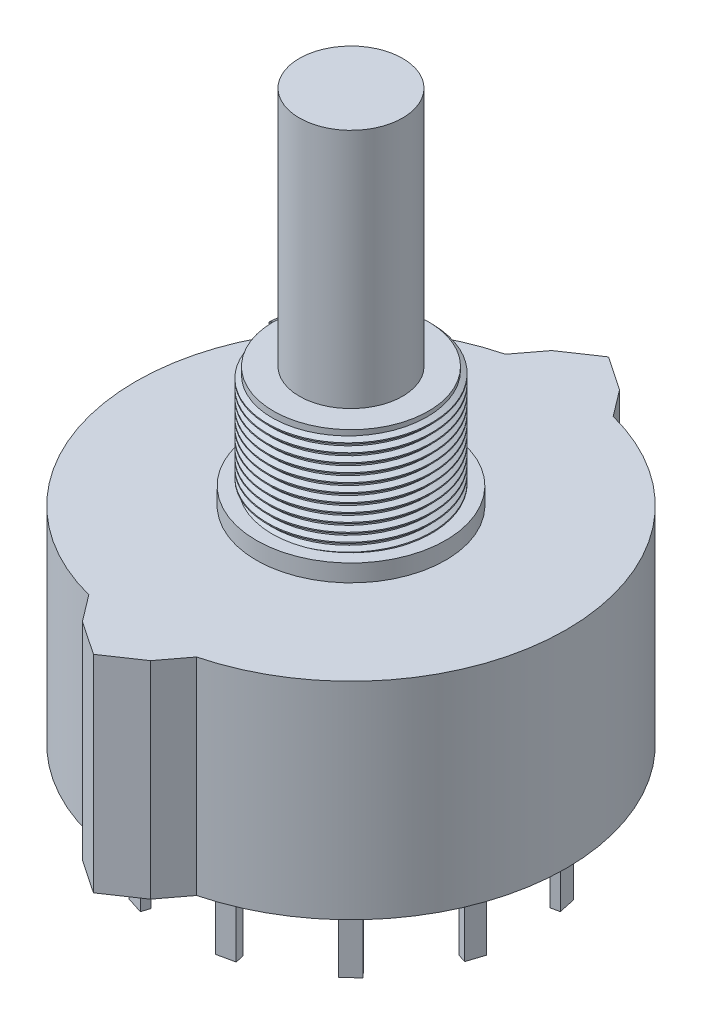
from build123d import *

# Parameters (mm, degrees)
EXTRUDE_1_DEPTH = 12
SKETCH_2_R      = 5.5
EXTRUDE_2_DEPTH = 1
SKETCH_3_R      = 4.5
EXTRUDE_3_DEPTH = 6
SKETCH_4_R      = 3
EXTRUDE_4_DEPTH = 14
SKETCH_5_W      = 1
SKETCH_5_H      = 0.5
EXTRUDE_5_DEPTH = 4.5
THREAD_1_PITCH  = 0.5


with BuildPart() as part:
    # Эскиз1 → Бобышка-Вытянуть1 (new body)
    with BuildSketch(Plane(origin=(0, 0, 0), x_dir=(1, 0, 0), z_dir=(0, 1, 0))):
        with BuildLine():
            Line((-3.127917221, 12.102319359), (-1.972687635, 13.627649499))
            Line((-1.972687635, 13.627649499), (0, 14.961195058))
            Line((0, 14.961195058), (1.972687635, 13.627649499))
            Line((1.972687635, 13.627649499), (3.127917221, 12.102319359))
            ThreePointArc((3.127917221, 12.102319359), (12.5, 0), (3.127917221, -12.102319359))
            Line((3.127917221, -12.102319359), (1.972687635, -13.627649499))
            Line((1.972687635, -13.627649499), (0, -14.961195058))
            Line((0, -14.961195058), (-1.972687635, -13.627649499))
            Line((-1.972687635, -13.627649499), (-3.127917221, -12.102319359))
            ThreePointArc((-3.127917221, -12.102319359), (-12.5, 0), (-3.127917221, 12.102319359))
        make_face()
    extrude(amount=EXTRUDE_1_DEPTH)

    # Sketch 2 → Бобышка-Вытянуть2 (add)
    with BuildSketch(Plane(origin=(0, 12, 0), x_dir=(1, 0, 0), z_dir=(0, 1, 0))):
        with Locations(Location((0, 0, 0), (0, 0, 270))):
            Circle(SKETCH_2_R)
    extrude(amount=EXTRUDE_2_DEPTH)

    # Эскиз3 → Бобышка-Вытянуть3 (add)
    with BuildSketch(Plane(origin=(0, 13, 0), x_dir=(1, 0, 0), z_dir=(0, 1, 0))):
        with Locations(Location((0, 0, 0), (0, 0, 270))):
            Circle(SKETCH_3_R)
    extrude(amount=EXTRUDE_3_DEPTH)

    # Эскиз4 → Бобышка-Вытянуть4 (add)
    with BuildSketch(Plane(origin=(0, 19, 0), x_dir=(1, 0, 0), z_dir=(0, 1, 0))):
        with Locations(Location((0, 0, 0), (0, 0, 270))):
            Circle(SKETCH_4_R)
    extrude(amount=EXTRUDE_4_DEPTH)

    # Эскиз5 → Бобышка-Вытянуть5 (add)
    with BuildSketch(Plane.XZ):
        with Locations((0, 5.5)):
            Rectangle(SKETCH_5_W, SKETCH_5_H)
        with Locations((0, -5.5)):
            Rectangle(SKETCH_5_W, SKETCH_5_H)
        Polygon((6.867995721, 7.591895736), (7.609573405, 6.92102873), (7.274139902, 6.550239888), (6.532562219, 7.221106894), align=None)
        Polygon((9.743806636, 3.140776709), (10.050598246, 2.188999998), (9.57470989, 2.035604193), (9.26791828, 2.987380904), align=None)
        Polygon((10.008772431, -2.1519109), (9.798573403, -3.129569516), (9.309744095, -3.024470002), (9.519943123, -2.046811386), align=None)
        Polygon((7.591895736, -6.867995721), (6.92102873, -7.609573405), (6.550239888, -7.274139902), (7.221106894, -6.532562219), align=None)
        Polygon((3.140776709, -9.743806636), (2.188999998, -10.050598246), (2.035604193, -9.57470989), (2.987380904, -9.26791828), align=None)
        Polygon((-2.1519109, -10.008772431), (-3.129569516, -9.798573403), (-3.024470002, -9.309744095), (-2.046811386, -9.519943123), align=None)
        Polygon((-6.867995721, -7.591895736), (-7.609573405, -6.92102873), (-7.274139902, -6.550239888), (-6.532562219, -7.221106894), align=None)
        Polygon((-9.743806636, -3.140776709), (-10.050598246, -2.188999998), (-9.57470989, -2.035604193), (-9.26791828, -2.987380904), align=None)
        Polygon((-10.008772431, 2.1519109), (-9.798573403, 3.129569516), (-9.309744095, 3.024470002), (-9.519943123, 2.046811386), align=None)
        Polygon((-7.591895736, 6.867995721), (-6.92102873, 7.609573405), (-6.550239888, 7.274139902), (-7.221106894, 6.532562219), align=None)
        Polygon((-3.140776709, 9.743806636), (-2.188999998, 10.050598246), (-2.035604193, 9.57470989), (-2.987380904, 9.26791828), align=None)
        Polygon((2.1519109, 10.008772431), (3.129569516, 9.798573403), (3.024470002, 9.309744095), (2.046811386, 9.519943123), align=None)
    extrude(amount=EXTRUDE_5_DEPTH)

    # Резьба1: the profile of Sketch 2 2 profile screwed along a right-hand helix of 12 turns, 6 arcs to a turn; built about Z, then put on its axis
    thread_1_z = Axis((0, 0, 0), (0, 0, 1))
    thread_1_corners = [(4.4997, 0, -0.000173205), (4.770632938, 0, 0.156249999), (4.770632938, 0, 0.218749999), (4.4997, 0, 0.375173204)]
    with BuildLine(mode=Mode.PRIVATE) as thread_1_profile:
        Line(thread_1_corners[0], thread_1_corners[1])
        Line(thread_1_corners[1], thread_1_corners[2])
        Line(thread_1_corners[2], thread_1_corners[3])
        Line(thread_1_corners[3], thread_1_corners[0])
    thread_1_cap = Face(thread_1_profile.wire())
    thread_1_turn_angles = [0, 30, 60, 90, 120, 150, 180, 210, 240, 270, 300, 330, 360]
    thread_1_turn_weights = [1, 0.8660254037844387, 1, 0.8660254037844387, 1, 0.8660254037844387, 1, 0.8660254037844387, 1, 0.8660254037844387, 1, 0.8660254037844387, 1]
    thread_1_turn_rails = [Edge.make_bspline([Vector(p[0], p[1], 0).rotate(thread_1_z, thread_1_turn_angles[k]) / thread_1_turn_weights[k] + Vector(0, 0, p[2] + THREAD_1_PITCH * thread_1_turn_angles[k] / 360) for k in range(13)], [0, 0, 0, 1, 1, 2, 2, 3, 3, 4, 4, 5, 5, 6, 6, 6], 2, thread_1_turn_weights) for p in thread_1_corners]
    thread_1_turn_sides = [Face.make_surface_from_curves(thread_1_turn_rails[p[0]], thread_1_turn_rails[p[1]]) for p in [(0, 1), (1, 2), (2, 3), (3, 0)]]
    thread_1 = Plane(origin=(0, 19, 0), x_dir=(-1, 0, 0), z_dir=(0, -1, 0)) * Solid(Shell([*[p.moved(Location((0, 0, THREAD_1_PITCH * i))) for i in range(12) for p in thread_1_turn_sides], thread_1_cap, thread_1_cap.rotate(thread_1_z, 4320).moved(Location((0, 0, THREAD_1_PITCH * 4320 / 360)))]))
    add(thread_1)


solid = part.part
